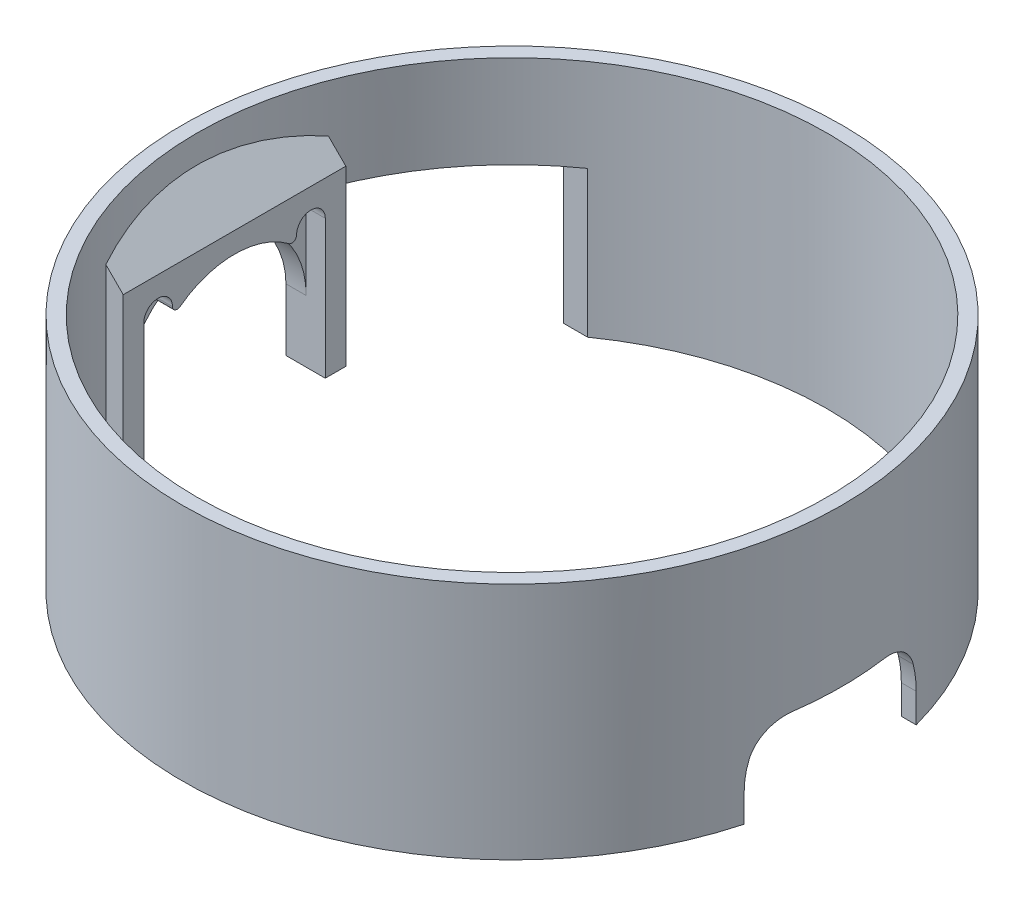
from build123d import *

# Parameters (mm, degrees)
SKETCH1_R           = 69
SKETCH1_R_2         = 66
BOSS_EXTRUDE1_DEPTH = 50
SKETCH4_W           = 30.6
SKETCH4_H           = 30.6
CUT_EXTRUDE2_DEPTH  = 110.644881321
CUT_EXTRUDE6_DEPTH  = 110.644881321
BOSS_EXTRUDE2_REACH = 169.745
BOSS_EXTRUDE2_START = -58.1
SKETCH8_W           = 46.6
SKETCH8_H           = 35
BOSS_EXTRUDE4_DEPTH = 30
SKETCH9_OUTSIDE_W   = 206.079
SKETCH9_OUTSIDE_H   = 183.51
SKETCH9_OUTSIDE_R   = 69
CUT_EXTRUDE7_DEPTH  = 126.083349102
CUT_EXTRUDE8_DEPTH  = 110.644881321
CUT_EXTRUDE9_DEPTH  = 110.644881321
CUT_EXTRUDE11_DEPTH = 4
FILLET3_R           = 1
CUT_EXTRUDE12_DEPTH = 110.644881493


with BuildPart() as part:
    # Sketch1 → Boss-Extrude1 (new body)
    with BuildSketch(Plane(origin=(0, 0, 0), x_dir=(1, 0, 0), z_dir=(0, 1, 0))):
        Circle(SKETCH1_R)
        Circle(SKETCH1_R_2, mode=Mode.SUBTRACT)
    extrude(amount=BOSS_EXTRUDE1_DEPTH)

    # Sketch4 → Cut-Extrude2 (cut, through all)
    with BuildSketch(Plane(origin=(0, 0, 0), x_dir=(0, 0, -1), z_dir=(1, 0, 0))):
        with Locations((38.6, 15.3)):
            Rectangle(SKETCH4_W, SKETCH4_H)
    extrude(amount=-CUT_EXTRUDE2_DEPTH, mode=Mode.SUBTRACT)

    # Sketch5 → Cut-Extrude6 (cut, through all)
    with BuildSketch(Plane(origin=(0, 0, 0), x_dir=(0, 0, -1), z_dir=(1, 0, 0))):
        with BuildLine():
            Line((19, 13), (19, -6))
            Line((19, -6), (-19, -6))
            Line((-19, -6), (-19, 13))
            ThreePointArc((-19, 13), (0, 32), (19, 13))
        make_face()
    extrude(amount=-CUT_EXTRUDE6_DEPTH, mode=Mode.SUBTRACT)

    # Sketch6 → Boss-Extrude2 (add, up to next)
    with BuildSketch(Plane(origin=(0, 0, 0), x_dir=(0, 0, -1), z_dir=(1, 0, 0)).offset(BOSS_EXTRUDE2_START), mode=Mode.PRIVATE) as boss_extrude2_sk1:
        with BuildLine():
            Line((19, 13), (19, 0))
            Line((19, 0), (23.3, 0))
            Line((23.3, 0), (23.3, 13))
            ThreePointArc((23.3, 13), (0, 36.3), (-23.3, 13))
            Line((-23.3, 13), (-23.3, 0))
            Line((-23.3, 0), (-19, 0))
            Line((-19, 0), (-19, 13))
            ThreePointArc((-19, 13), (0, 32), (19, 13))
        make_face()
    boss_extrude2_tool1 = extrude(boss_extrude2_sk1.sketch, amount=-BOSS_EXTRUDE2_REACH, mode=Mode.PRIVATE) - part.part
    add(boss_extrude2_tool1.solids().sort_by_distance((-58.1, 6.5, 22.709301))[0])

    # Sketch8 → Boss-Extrude4 (add)
    with BuildSketch(Plane(origin=(-10.9, -10.9, 0), x_dir=(0, 0, -1), z_dir=(-0.7071067811865512, -0.7071067811865438, 0))):
        with Locations((0, -66.582903987)):
            Rectangle(SKETCH8_W, SKETCH8_H)
    extrude(amount=BOSS_EXTRUDE4_DEPTH)

    # Sketch9 outside → Cut-Extrude7 (cut, through all)
    with BuildSketch(Plane.XZ):
        with Locations((-11.2845, 0)):
            Rectangle(SKETCH9_OUTSIDE_W, SKETCH9_OUTSIDE_H)
        Circle(SKETCH9_OUTSIDE_R, mode=Mode.SUBTRACT)
    extrude(amount=-CUT_EXTRUDE7_DEPTH, mode=Mode.SUBTRACT)

    # Sketch9<3> → Cut-Extrude8 (cut, through all)
    with BuildSketch(Plane.XZ):
        with BuildLine():
            Line((-58.1, -19), (-58.1, -23.3))
            Line((-58.1, -23.3), (-61.750384614, -23.3))
            ThreePointArc((-61.750384614, -23.3), (-52.211852364, -40.372298334), (-38.089237325, -53.9))
            ThreePointArc((-38.089237325, -53.9), (63.102674486, 19.340436209), (-61.750384614, 23.3))
            Line((-61.750384614, 23.3), (-58.1, 23.3))
            Line((-58.1, 23.3), (-58.1, 19))
            Line((-58.1, 19), (-58.1, -19))
        make_face()
    extrude(amount=-CUT_EXTRUDE8_DEPTH, mode=Mode.SUBTRACT)

    # Sketch5<2> → Cut-Extrude9 (cut, through all)
    with BuildSketch(Plane(origin=(0, 0, 0), x_dir=(0, 0, -1), z_dir=(1, 0, 0))):
        with BuildLine():
            Line((19, 13), (19, -6))
            Line((19, -6), (-19, -6))
            Line((-19, -6), (-19, 13))
            ThreePointArc((-19, 13), (0, 32), (19, 13))
        make_face()
    extrude(amount=-CUT_EXTRUDE9_DEPTH, mode=Mode.SUBTRACT)

    # Sketch11 → Cut-Extrude11 (cut)
    with BuildSketch(Plane(origin=(-58.1, 0, 0), x_dir=(0, 0, -1), z_dir=(1, 0, 0))):
        with BuildLine():
            Line((-19.000000298, 29.000000238), (-19, 11.000000238))
            Line((-19, 11.000000238), (-13.000000298, 11.000000238))
            Line((-13.000000298, 11.000000238), (-13.000000298, 29.000000238))
            ThreePointArc((-13.000000298, 29.000000238), (-16.000000298, 32.000000238), (-19.000000298, 29.000000238))
        make_face()
        with BuildLine():
            Line((12.999999702, 29.000000238), (12.999999702, 11.000000238))
            Line((12.999999702, 11.000000238), (19, 11.000000238))
            Line((19, 11.000000238), (18.999999702, 29.000000238))
            ThreePointArc((18.999999702, 29.000000238), (15.999999702, 32.000000238), (12.999999702, 29.000000238))
        make_face()
    extrude(amount=-CUT_EXTRUDE11_DEPTH, mode=Mode.SUBTRACT)

    # Fillet3
    fillet3_edges = [part.edges().sort_by_distance(p)[0] for p in [
        (-60.1, 26.85640674, -12.999999702),
        (-60.1, 26.856406181, 13.000000298),
    ]]
    fillet(fillet3_edges, radius=FILLET3_R)

    # Sketch12 → Cut-Extrude12 (cut, through all)
    with BuildSketch(Plane(origin=(0, 0, 0), x_dir=(0, 0, -1), z_dir=(1, 0, 0))):
        with BuildLine():
            Line((-18, -0.9), (18, -0.9))
            Line((18, -0.9), (18, 6.10000124))
            ThreePointArc((18, 6.10000124), (17.791519065, 8.831639827), (17.170905626, 11.50000124))
            ThreePointArc((17.170905626, 11.50000124), (14.272255841, 15.549807439), (9.539392014, 17.10000124))
            Line((9.539392014, 17.10000124), (-9.539392014, 17.10000124))
            ThreePointArc((-9.539392014, 17.10000124), (-14.272255841, 15.549807439), (-17.170905626, 11.50000124))
            ThreePointArc((-17.170905626, 11.50000124), (-17.791519065, 8.831639827), (-18, 6.10000124))
            Line((-18, 6.10000124), (-18, -0.9))
        make_face()
    extrude(amount=CUT_EXTRUDE12_DEPTH, mode=Mode.SUBTRACT)


solid = part.part
